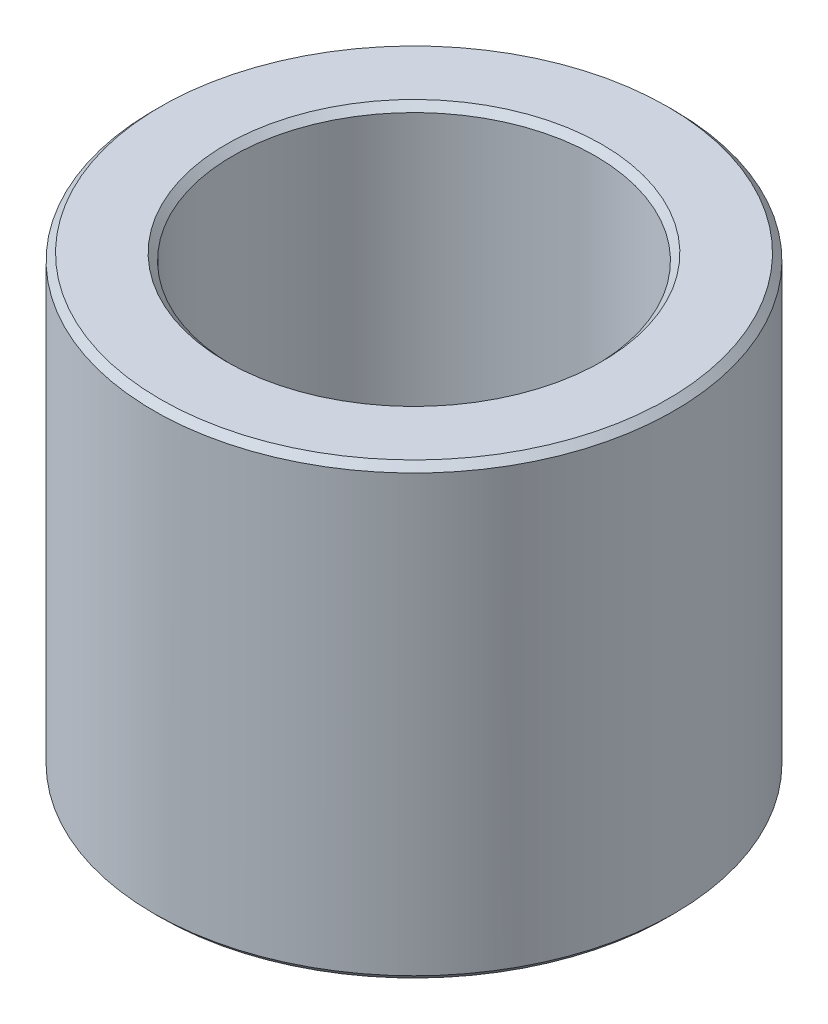
from build123d import *

# Parameters (mm, degrees)
SKETCH1_R           = 35
BOSS_EXTRUDE1_DEPTH = 60.358140114
SKETCH2_R           = 24.398986901
CUT_EXTRUDE1_DEPTH  = 79.058344064
CHAMFER1_SIZE       = 0.89399991


with BuildPart() as part:
    # Sketch1 → Boss-Extrude1 (new body)
    with BuildSketch(Plane(origin=(0, 0, 0), x_dir=(1, 0, 0), z_dir=(0, 1, 0))):
        Circle(SKETCH1_R)
    extrude(amount=BOSS_EXTRUDE1_DEPTH)

    # Sketch2 → Cut-Extrude1 (cut, through all)
    with BuildSketch(Plane(origin=(0, 0, 0), x_dir=(1, 0, 0), z_dir=(0, 1, 0))):
        Circle(SKETCH2_R)
    extrude(amount=CUT_EXTRUDE1_DEPTH, mode=Mode.SUBTRACT)

    # Chamfer1
    chamfer1_edges = [part.edges().sort_by_distance(p)[0] for p in [
        (-24.398986901, 60.358140114, 0),
        (-24.398986901, 0, 0),
        (-35, 0, 0),
        (-35, 60.358140114, 0),
    ]]
    chamfer(chamfer1_edges, length=CHAMFER1_SIZE)


solid = part.part
